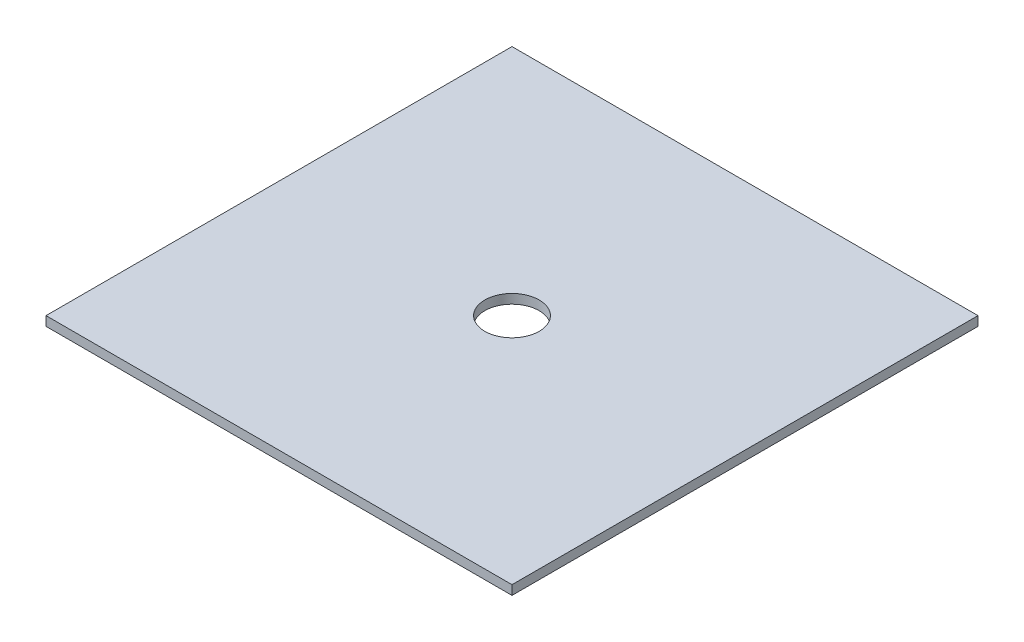
from build123d import *

# Parameters (mm, degrees)
ESQUISSE1_W                  = 300
ESQUISSE1_H                  = 300
BOSS_EXTRU_1_DEPTH           = 6
ENL_V_MAT_EXTRU_1_DEPTH      = 213.216870206
ENL_V_MAT_EXTRU_1_DEPTH_BACK = 213.216870206
ESQUISSE2_R                  = 17.5


with BuildPart() as part:
    # Esquisse1 → Boss.-Extru.1 (new body)
    with BuildSketch(Plane(origin=(0, 0, 0), x_dir=(1, 0, 0), z_dir=(0, 1, 0))):
        Rectangle(ESQUISSE1_W, ESQUISSE1_H)
    extrude(amount=BOSS_EXTRU_1_DEPTH)

    # Esquisse2 → Enlèv. mat.-Extru.1 (cut, two sides: drawn at the far end of the back side and taken through both)
    with BuildSketch(Plane(origin=(0, 6, 0), x_dir=(1, 0, 0), z_dir=(0, 1, 0)).offset(-ENL_V_MAT_EXTRU_1_DEPTH_BACK)):
        Circle(ESQUISSE2_R)
    extrude(amount=ENL_V_MAT_EXTRU_1_DEPTH + ENL_V_MAT_EXTRU_1_DEPTH_BACK, mode=Mode.SUBTRACT)


solid = part.part
